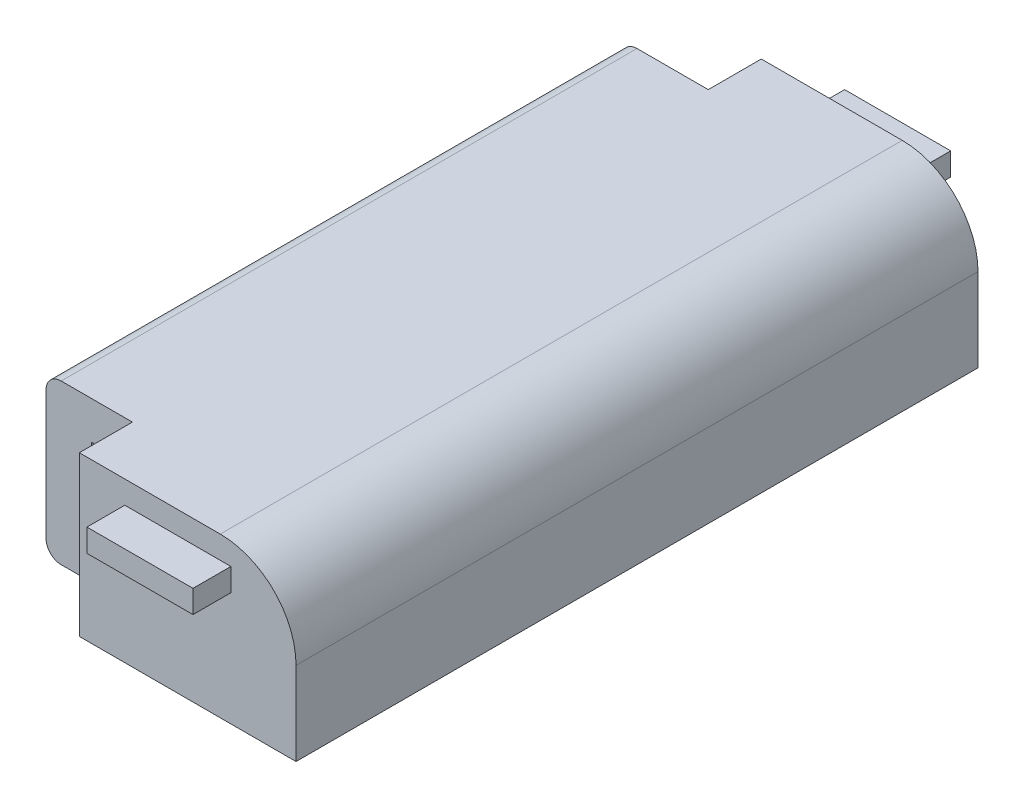
from build123d import *

# Parameters (mm, degrees)
BOSS_EXTRUDE1_DEPTH = 96.52
SKETCH3_W           = 36.322
SKETCH3_H           = 26.67
BOSS_EXTRUDE3_DEPTH = 8.89
SKETCH2_W           = 17.78
SKETCH2_H           = 3.81
BOSS_EXTRUDE4_DEPTH = 6.35
FILLET1_R           = 12.7
FILLET2_R           = 2.54


with BuildPart() as part:
    # Sketch1 → Boss-Extrude1 (new body)
    with BuildSketch(Plane.XY):
        Polygon((0, 0), (0, -20.32), (-7.62, -20.32), (-7.62, 6.35), (43.18, 6.35), (43.18, -20.32), (6.858, -20.32), (6.858, 0), align=None)
    extrude(amount=BOSS_EXTRUDE1_DEPTH)

    # Sketch3 → Boss-Extrude3 (add)
    with BuildSketch(Plane.XY.offset(96.52)):
        with Locations((25.019, -6.985)):
            Rectangle(SKETCH3_W, SKETCH3_H)
    boss_extrude3 = extrude(amount=BOSS_EXTRUDE3_DEPTH)

    # Sketch2 → Boss-Extrude4 (add)
    with BuildSketch(Plane(origin=(0, 0, 105.41), x_dir=(-1, 0, 0), z_dir=(0, 0, -1))):
        with Locations((-23.368, 0.635)):
            Rectangle(SKETCH2_W, SKETCH2_H)
    boss_extrude4 = extrude(amount=-BOSS_EXTRUDE4_DEPTH)

    # Mirror2: Boss-Extrude3, Boss-Extrude4 across plane
    add(boss_extrude3.mirror(Plane(origin=(0, 0, 48.26), x_dir=(1, 0, 0), z_dir=(0, 0, -1))))
    add(boss_extrude4.mirror(Plane(origin=(0, 0, 48.26), x_dir=(1, 0, 0), z_dir=(0, 0, -1))))

    # Fillet1
    fillet1_edges = [part.edges().sort_by_distance(p)[0] for p in [
        (43.18, 6.35, 48.26),
    ]]
    fillet(fillet1_edges, radius=FILLET1_R)

    # Fillet2
    fillet2_edges = [part.edges().sort_by_distance(p)[0] for p in [
        (-7.62, -20.32, 48.26),
        (-7.62, 6.35, 48.26),
    ]]
    fillet(fillet2_edges, radius=FILLET2_R)


solid = part.part
